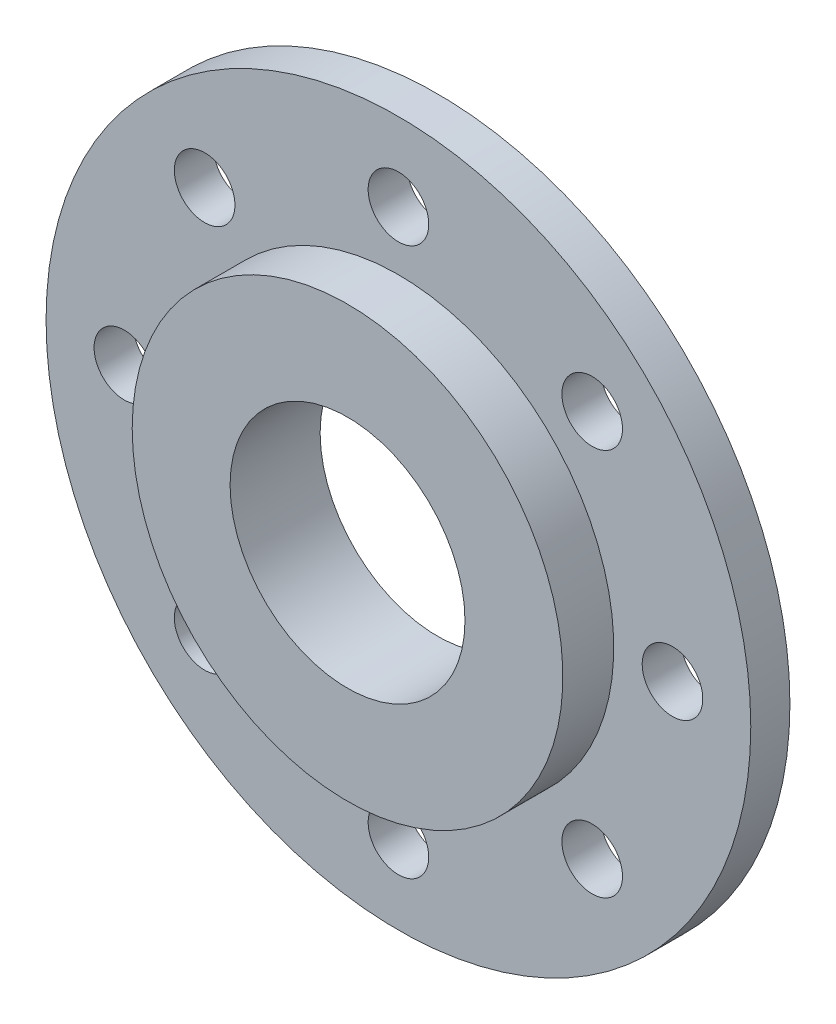
from build123d import *

# Parameters (mm, degrees)
SKETCH1_R                    = 17.4625
BOSS_EXTRUDE1_DEPTH          = 4.1275
SKETCH2_R                    = 28.575
BOSS_EXTRUDE2_DEPTH          = 3.175
F_10_0_1935_DIAMETER_HOLE1_D = 4.9149
CIRPATTERN1_COUNT            = 8
CUT_EXTRUDE1_REACH           = 43.066
SKETCH5_R                    = 9.525


with BuildPart() as part:
    # Sketch1 → Boss-Extrude1 (new body)
    with BuildSketch(Plane.XY):
        Circle(SKETCH1_R)
    extrude(amount=BOSS_EXTRUDE1_DEPTH)

    # Sketch2 → Boss-Extrude2 (add)
    with BuildSketch(Plane(origin=(0, 0, 0), x_dir=(-1, 0, 0), z_dir=(0, 0, -1))):
        Circle(SKETCH2_R)
    extrude(amount=BOSS_EXTRUDE2_DEPTH)

    # #10 (0.1935) Diameter Hole1 (through all)
    with Locations(Plane(origin=(0, 0, -3.175), x_dir=(-1, 0, 0), z_dir=(0, 0, -1))):
        with Locations((0, 22.225)):
            f_10_0_1935_diameter_hole1 = Hole(F_10_0_1935_DIAMETER_HOLE1_D / 2)

    # CirPattern1: #10 (0.1935) Diameter Hole1 ×8 about axis
    cirpattern1_axis = Axis((0, 0, -3.175), (0, 0, -1))
    for i in range(1, CIRPATTERN1_COUNT):
        add(f_10_0_1935_diameter_hole1.rotate(cirpattern1_axis, i * 360 / CIRPATTERN1_COUNT), mode=Mode.SUBTRACT)

    # Sketch5 → Cut-Extrude1 (cut, up to next)
    with BuildSketch(Plane(origin=(0, 0, -3.175), x_dir=(-1, 0, 0), z_dir=(0, 0, -1)), mode=Mode.PRIVATE) as cut_extrude1_sk1:
        Circle(SKETCH5_R)
    cut_extrude1_tool1 = extrude(cut_extrude1_sk1.sketch, amount=-CUT_EXTRUDE1_REACH, mode=Mode.PRIVATE) & part.part
    add(cut_extrude1_tool1.solids().sort_by_distance((0, 0, -3.175))[0], mode=Mode.SUBTRACT)


solid = part.part
